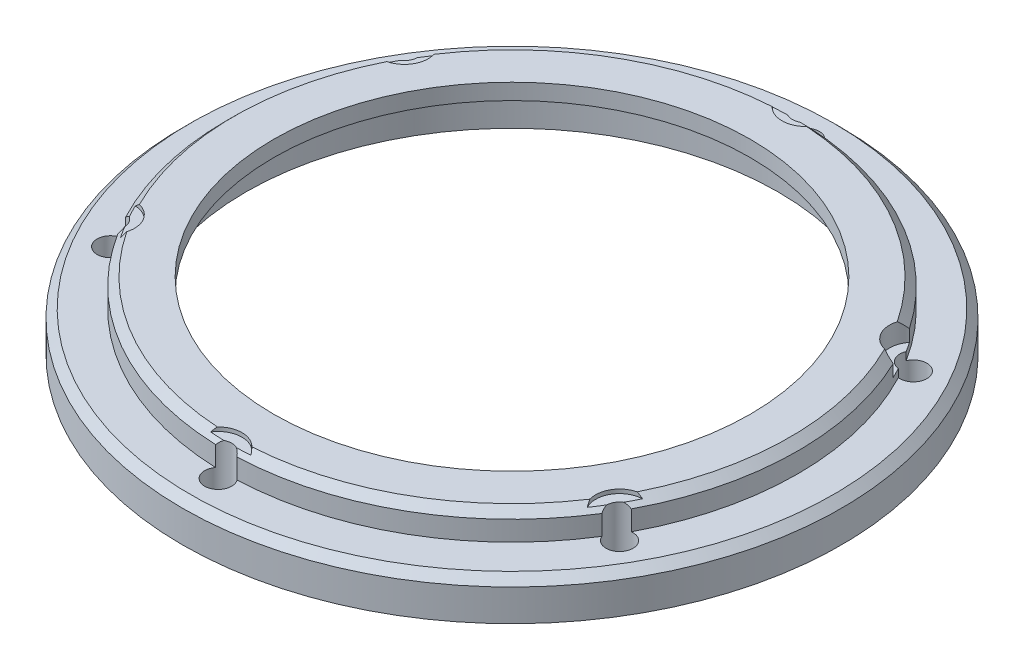
from build123d import *

# Parameters (mm, degrees)
SKETCH_3_R                      = 1.7
CUT_EXTRUDE_1_DEPTH             = 10
CUT_EXTRUDE_1_DIRECTION_2_REACH = 60.902
CUT_EXTRUDE_START               = 3
SKETCH_4_R                      = 3
CUT_EXTRUDE_2_DEPTH             = 3
SKETCH_7_R                      = 3
CUT_EXTRUDE_3_DEPTH             = 10
EXTRUDE_1_DEPTH                 = 1
CHAMFER_1_SIZE                  = 1


with BuildPart() as part:
    # 草图2 → 旋转1 (revolve)
    with BuildSketch(Plane(origin=(0, 0, 0), x_dir=(0, 0, -1), z_dir=(1, 0, 0)), mode=Mode.PRIVATE) as revolve_1_sk:
        Polygon((-30, 0), (-30, 2), (-36, 2), (-36, -1.5), (-41.5, -1.5), (-41.5, -6.5), (-35, -6.5), (-35, -5.5), (-33.5, -5.5), (-33.5, 0), align=None)
    revolve(revolve_1_sk.sketch.rotate(Axis((0, 0, 0), (0, 1, 0)), 180), axis=Axis((0, 0, 0), (0, 1, 0)))

    # 草图3 → 切除-拉伸1 (cut)
    with BuildSketch(Plane(origin=(0, -1.5, 0), x_dir=(1, 0, 0), z_dir=(0, 1, 0))):
        with Locations(Location((0, 37, 0), (0, 0, 217.103674805))):
            Circle(SKETCH_3_R)
        with Locations(Location((32.04293994, 18.5, 0), (0, 0, 157.103674805))):
            Circle(SKETCH_3_R)
        with Locations(Location((32.04293994, -18.5, 0), (0, 0, 97.103674805))):
            Circle(SKETCH_3_R)
        with Locations(Location((0, -37, 0), (0, 0, 37.103674804))):
            Circle(SKETCH_3_R)
        with Locations(Location((-32.04293994, -18.5, 0), (0, 0, 82.896325196))):
            Circle(SKETCH_3_R)
        with Locations(Location((-32.04293994, 18.5, 0), (0, 0, 22.896325196))):
            Circle(SKETCH_3_R)
    extrude(amount=-CUT_EXTRUDE_1_DEPTH, mode=Mode.SUBTRACT)

    # 草图3 → 切除-拉伸1 direction 2 (cut, up to next)
    with BuildSketch(Plane(origin=(0, -1.5, 0), x_dir=(1, 0, 0), z_dir=(0, 1, 0)), mode=Mode.PRIVATE) as cut_extrude_1_direction_2_sk1:
        with Locations(Location((0, 37, 0), (0, 0, 217.103674805))):
            Circle(SKETCH_3_R)
    cut_extrude_1_direction_2_tool1 = extrude(cut_extrude_1_direction_2_sk1.sketch, amount=CUT_EXTRUDE_1_DIRECTION_2_REACH, mode=Mode.PRIVATE) & part.part
    # 草图3 → 切除-拉伸1 direction 2 (cut, up to next)
    with BuildSketch(Plane(origin=(0, -1.5, 0), x_dir=(1, 0, 0), z_dir=(0, 1, 0)), mode=Mode.PRIVATE) as cut_extrude_1_direction_2_sk2:
        with Locations(Location((32.04293994, 18.5, 0), (0, 0, 157.103674805))):
            Circle(SKETCH_3_R)
    cut_extrude_1_direction_2_tool2 = extrude(cut_extrude_1_direction_2_sk2.sketch, amount=CUT_EXTRUDE_1_DIRECTION_2_REACH, mode=Mode.PRIVATE) & part.part
    # 草图3 → 切除-拉伸1 direction 2 (cut, up to next)
    with BuildSketch(Plane(origin=(0, -1.5, 0), x_dir=(1, 0, 0), z_dir=(0, 1, 0)), mode=Mode.PRIVATE) as cut_extrude_1_direction_2_sk3:
        with Locations(Location((32.04293994, -18.5, 0), (0, 0, 97.103674805))):
            Circle(SKETCH_3_R)
    cut_extrude_1_direction_2_tool3 = extrude(cut_extrude_1_direction_2_sk3.sketch, amount=CUT_EXTRUDE_1_DIRECTION_2_REACH, mode=Mode.PRIVATE) & part.part
    # 草图3 → 切除-拉伸1 direction 2 (cut, up to next)
    with BuildSketch(Plane(origin=(0, -1.5, 0), x_dir=(1, 0, 0), z_dir=(0, 1, 0)), mode=Mode.PRIVATE) as cut_extrude_1_direction_2_sk4:
        with Locations(Location((0, -37, 0), (0, 0, 37.103674804))):
            Circle(SKETCH_3_R)
    cut_extrude_1_direction_2_tool4 = extrude(cut_extrude_1_direction_2_sk4.sketch, amount=CUT_EXTRUDE_1_DIRECTION_2_REACH, mode=Mode.PRIVATE) & part.part
    # 草图3 → 切除-拉伸1 direction 2 (cut, up to next)
    with BuildSketch(Plane(origin=(0, -1.5, 0), x_dir=(1, 0, 0), z_dir=(0, 1, 0)), mode=Mode.PRIVATE) as cut_extrude_1_direction_2_sk5:
        with Locations(Location((-32.04293994, -18.5, 0), (0, 0, 82.896325196))):
            Circle(SKETCH_3_R)
    cut_extrude_1_direction_2_tool5 = extrude(cut_extrude_1_direction_2_sk5.sketch, amount=CUT_EXTRUDE_1_DIRECTION_2_REACH, mode=Mode.PRIVATE) & part.part
    # 草图3 → 切除-拉伸1 direction 2 (cut, up to next)
    with BuildSketch(Plane(origin=(0, -1.5, 0), x_dir=(1, 0, 0), z_dir=(0, 1, 0)), mode=Mode.PRIVATE) as cut_extrude_1_direction_2_sk6:
        with Locations(Location((-32.04293994, 18.5, 0), (0, 0, 22.896325196))):
            Circle(SKETCH_3_R)
    cut_extrude_1_direction_2_tool6 = extrude(cut_extrude_1_direction_2_sk6.sketch, amount=CUT_EXTRUDE_1_DIRECTION_2_REACH, mode=Mode.PRIVATE) & part.part
    add(cut_extrude_1_direction_2_tool1.solids().sort_by_distance((0, -1.5, -37))[0], mode=Mode.SUBTRACT)
    add(cut_extrude_1_direction_2_tool2.solids().sort_by_distance((32.04294, -1.5, -18.5))[0], mode=Mode.SUBTRACT)
    add(cut_extrude_1_direction_2_tool3.solids().sort_by_distance((32.04294, -1.5, 18.5))[0], mode=Mode.SUBTRACT)
    add(cut_extrude_1_direction_2_tool4.solids().sort_by_distance((0, -1.5, 37))[0], mode=Mode.SUBTRACT)
    add(cut_extrude_1_direction_2_tool5.solids().sort_by_distance((-32.04294, -1.5, 18.5))[0], mode=Mode.SUBTRACT)
    add(cut_extrude_1_direction_2_tool6.solids().sort_by_distance((-32.04294, -1.5, -18.5))[0], mode=Mode.SUBTRACT)

    # 草图4 → 切除-拉伸2 (cut)
    with BuildSketch(Plane(origin=(0, -1.5, 0), x_dir=(1, 0, 0), z_dir=(0, 1, 0)).offset(CUT_EXTRUDE_START)):
        with Locations((0, 37)):
            Circle(SKETCH_4_R)
        with Locations((32.04293994, 18.5)):
            Circle(SKETCH_4_R)
        with Locations((32.04293994, -18.5)):
            Circle(SKETCH_4_R)
        with Locations((0, -37)):
            Circle(SKETCH_4_R)
        with Locations((-32.04293994, -18.5)):
            Circle(SKETCH_4_R)
        with Locations((-32.04293994, 18.5)):
            Circle(SKETCH_4_R)
    extrude(amount=CUT_EXTRUDE_2_DEPTH, mode=Mode.SUBTRACT)

    # 草图7 → 切除-拉伸3 (cut)
    with BuildSketch(Plane(origin=(0, -1.5, 0), x_dir=(1, 0, 0), z_dir=(0, 1, 0))):
        with Locations((32.04293994, 18.5)):
            Circle(SKETCH_7_R)
    extrude(amount=CUT_EXTRUDE_3_DEPTH, mode=Mode.SUBTRACT)

    # 草图8 → 凸台-拉伸1 (add)
    with BuildSketch(Plane(origin=(0, -1.5, 0), x_dir=(1, 0, 0), z_dir=(0, 1, 0))):
        with BuildLine():
            ThreePointArc((30.476882326, 19.161410274), (30.089095942, 19.764774357), (29.689366173, 20.360293128))
            ThreePointArc((29.689366173, 20.360293128), (29.444863729, 17), (32.477214164, 15.531598764))
            ThreePointArc((32.477214164, 15.531598764), (32.161344664, 16.175534285), (31.832709232, 16.813049186))
            ThreePointArc((31.832709232, 16.813049186), (30.570696754, 17.65), (30.476882326, 19.161410274))
        make_face()
    extrude(amount=EXTRUDE_1_DEPTH)

    # 倒角1
    # the kernel refuses this chamfer: 1 mm, written as the material it takes off along each edge
    with BuildSketch(Plane(origin=(0, 2, 0), x_dir=(0.00607290176343859, 0, 0.9999815597620647), z_dir=(-0.9999815597620647, 0, 0.00607290176343859))) as chamfer_1_piece_1:
        Polygon((36 - CHAMFER_1_SIZE, 0), (36, -CHAMFER_1_SIZE), (36, 0), align=None)
    revolve(axis=Axis((0, 2, 0), (0, 1, 0)), revolution_arc=59.304092442, mode=Mode.SUBTRACT)
    with BuildSketch(Plane(origin=(0, 2, 0), x_dir=(-0.8629729831882226, 0, 0.5052500670828455), z_dir=(-0.5052500670828455, 0, -0.8629729831882226))) as chamfer_1_piece_2:
        Polygon((36 - CHAMFER_1_SIZE, 0), (36, -CHAMFER_1_SIZE), (36, 0), align=None)
    revolve(axis=Axis((0, 2, 0), (0, 1, 0)), revolution_arc=59.304092442, mode=Mode.SUBTRACT)
    with BuildSketch(Plane(origin=(0, 2, 0), x_dir=(-0.8690458849516061, 0, -0.49473149267929145), z_dir=(0.49473149267929145, 0, -0.8690458849516061))) as chamfer_1_piece_3:
        Polygon((36 - CHAMFER_1_SIZE, 0), (36, -CHAMFER_1_SIZE), (36, 0), align=None)
    revolve(axis=Axis((0, 2, 0), (0, 1, 0)), revolution_arc=59.304092442, mode=Mode.SUBTRACT)
    with BuildSketch(Plane(origin=(0, 2, 0), x_dir=(-0.00607290176325947, 0, -0.9999815597620656), z_dir=(0.9999815597620656, 0, -0.00607290176325947))) as chamfer_1_piece_4:
        Polygon((36 - CHAMFER_1_SIZE, 0), (36, -CHAMFER_1_SIZE), (36, 0), align=None)
    revolve(axis=Axis((0, 2, 0), (0, 1, 0)), revolution_arc=59.304092442, mode=Mode.SUBTRACT)
    with BuildSketch(Plane(origin=(0, 2, 0), x_dir=(0.8629729831882953, 0, -0.5052500670827214), z_dir=(0.5052500670827214, 0, 0.8629729831882953))) as chamfer_1_piece_5:
        Polygon((36 - CHAMFER_1_SIZE, 0), (36, -CHAMFER_1_SIZE), (36, 0), align=None)
    revolve(axis=Axis((0, 2, 0), (0, 1, 0)), revolution_arc=59.304092442, mode=Mode.SUBTRACT)
    with BuildSketch(Plane(origin=(0, -1.5, 0), x_dir=(0, 0, -1), z_dir=(1, 0, 0))) as chamfer_1_piece_6:
        Polygon((41.5 - CHAMFER_1_SIZE, 0), (41.5, -CHAMFER_1_SIZE), (41.5, 0), align=None)
    revolve(axis=Axis((0, -1.5, 0), (0, 1, 0)), mode=Mode.SUBTRACT)
    with BuildSketch(Plane(origin=(0, 2, 0), x_dir=(0.8690458849516187, 0, 0.49473149267926925), z_dir=(-0.49473149267926925, 0, 0.8690458849516187))) as chamfer_1_piece_7:
        Polygon((36 - CHAMFER_1_SIZE, 0), (36, -CHAMFER_1_SIZE), (36, 0), align=None)
    revolve(axis=Axis((0, 2, 0), (0, 1, 0)), revolution_arc=59.304092442, mode=Mode.SUBTRACT)


solid = part.part
